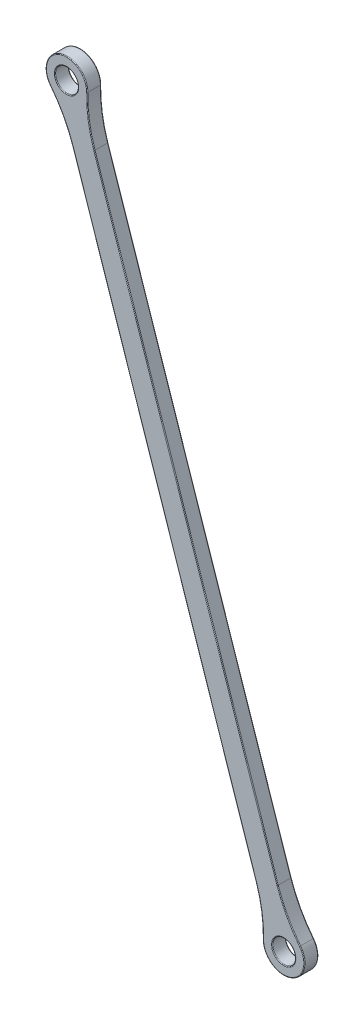
from build123d import *

# Parameters (mm, degrees)
SKETCH_1_R      = 2.5
EXTRUDE_1_DEPTH = 3
FILLET_1_R      = 30
FILLET_2_R      = 0.15


with BuildPart() as part:
    # 草图1 → 凸台-拉伸1 (new body)
    with BuildSketch(Plane.XY):
        with BuildLine():
            ThreePointArc((10.937942583, 84.24986308), (15.934075721, 77.234624656), (15.677248521, 85.843280548))
            Line((15.677248521, 85.843280548), (-29.103099632, 219.033592682))
            ThreePointArc((-29.103099632, 219.033592682), (-34.09923277, 226.048831106), (-33.84240557, 217.440175214))
            Line((-33.84240557, 217.440175214), (10.937942583, 84.24986308))
        make_face()
        with Locations((14.5, 81.5)):
            Circle(SKETCH_1_R, mode=Mode.SUBTRACT)
        with Locations((-32.665157049, 221.783455762)):
            Circle(SKETCH_1_R, mode=Mode.SUBTRACT)
    extrude(amount=-EXTRUDE_1_DEPTH)

    # 圆角1
    fillet_1_edges = [part.edges().sort_by_distance(p)[0] for p in [
        (10.937942583, 84.24986308, -1.5),
        (15.677248521, 85.843280548, -1.5),
        (-29.103099632, 219.033592682, -1.5),
        (-33.84240557, 217.440175214, -1.5),
    ]]
    fillet(fillet_1_edges, radius=FILLET_1_R)

    # 圆角2
    fillet_2_edges = [part.edges().sort_by_distance(p)[0] for p in [
        (12, 81.5, -3),
        (-33.388614274, 214.716121766, -3),
        (-34.09923277, 226.048831106, -3),
        (-27.819020395, 216.588693044, -3),
        (-6.712925555, 152.438436615, -3),
        (15.223457225, 88.567333996, -3),
        (15.934075721, 77.234624656, -3),
        (9.653863346, 86.694762718, -3),
        (-11.452231493, 150.845019147, -3),
        (-35.165157049, 221.783455762, -3),
        (12, 81.5, 0),
        (15.223457225, 88.567333996, 0),
        (-6.712925555, 152.438436615, 0),
        (-27.819020395, 216.588693044, 0),
        (-34.09923277, 226.048831106, 0),
        (-33.388614274, 214.716121766, 0),
        (-11.452231493, 150.845019147, 0),
        (9.653863346, 86.694762718, 0),
        (15.934075721, 77.234624656, 0),
        (-35.165157049, 221.783455762, 0),
    ]]
    fillet(fillet_2_edges, radius=FILLET_2_R)


solid = part.part
